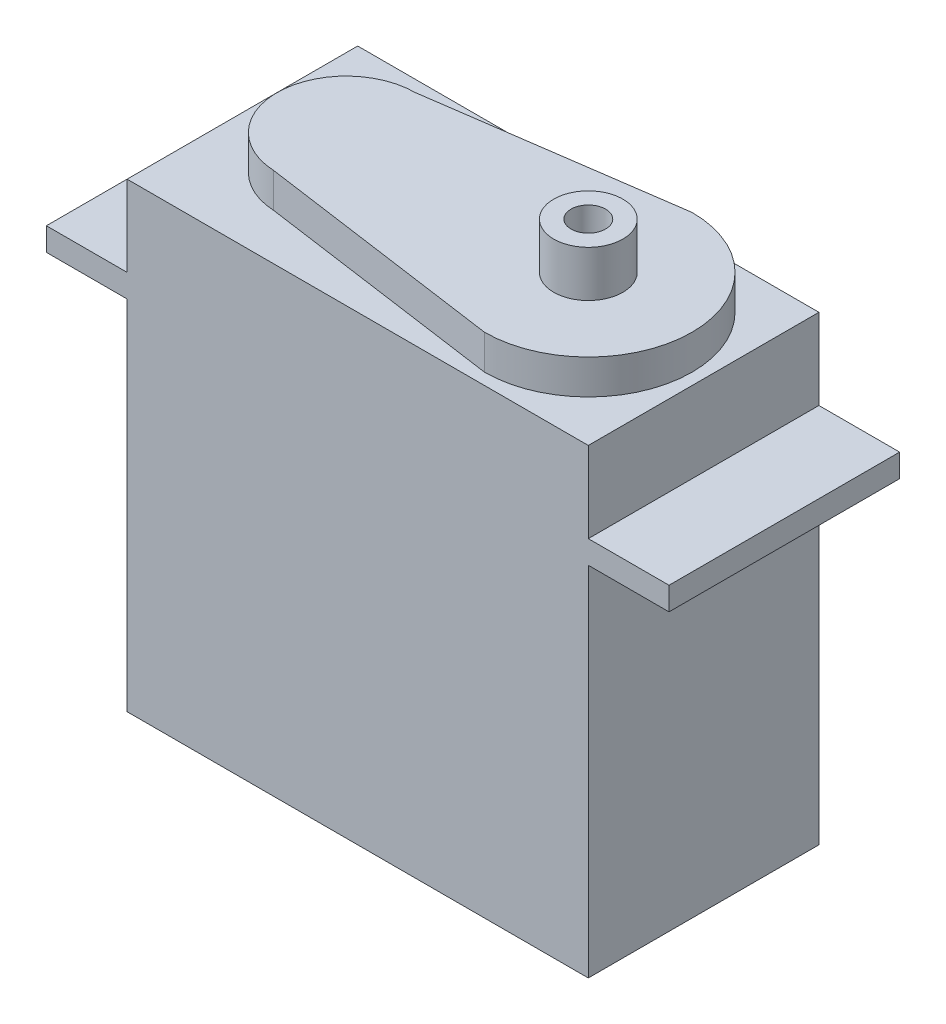
from build123d import *

# Parameters (mm, degrees)
SKETCH_1_W      = 40
SKETCH_1_H      = 40
EXTRUDE_1_DEPTH = 20
EXTRUDE_2_DEPTH = 3
SKETCH_5_R      = 3
SKETCH_5_R_2    = 1.5
EXTRUDE_3_DEPTH = 4
SKETCH_6_W      = 7
SKETCH_6_H      = 2
EXTRUDE_4_DEPTH = 20


with BuildPart() as part:
    # 草图1 → 凸台-拉伸1 (new body)
    with BuildSketch(Plane.XY):
        Rectangle(SKETCH_1_W, SKETCH_1_H)
    extrude(amount=EXTRUDE_1_DEPTH)

    # 草图2 → 凸台-拉伸2 (add)
    with BuildSketch(Plane(origin=(0, 20, 0), x_dir=(1, 0, 0), z_dir=(0, 1, 0))):
        with BuildLine():
            Line((10, -1), (-11, -4))
            ThreePointArc((-11, -4), (-16.99824603, -9.854932566), (-11.290050053, -15.992985147))
            Line((-11.290050053, -15.992985147), (10, -19))
            ThreePointArc((10, -19), (19, -10), (10, -1))
        make_face()
    extrude(amount=EXTRUDE_2_DEPTH)

    # 草图5 → 凸台-拉伸3 (add)
    with BuildSketch(Plane(origin=(0, 23, 0), x_dir=(1, 0, 0), z_dir=(0, 1, 0))):
        with Locations((10, -10)):
            Circle(SKETCH_5_R)
        with Locations((10, -10)):
            Circle(SKETCH_5_R_2, mode=Mode.SUBTRACT)
    extrude(amount=EXTRUDE_3_DEPTH)

    # 草图6 → 凸台-拉伸4 (add)
    with BuildSketch(Plane(origin=(0, 0, 0), x_dir=(-1, 0, 0), z_dir=(0, 0, -1))):
        with Locations((-23.5, 12)):
            Rectangle(SKETCH_6_W, SKETCH_6_H)
        with Locations((23.5, 12)):
            Rectangle(SKETCH_6_W, SKETCH_6_H)
    extrude(amount=-EXTRUDE_4_DEPTH)


solid = part.part
